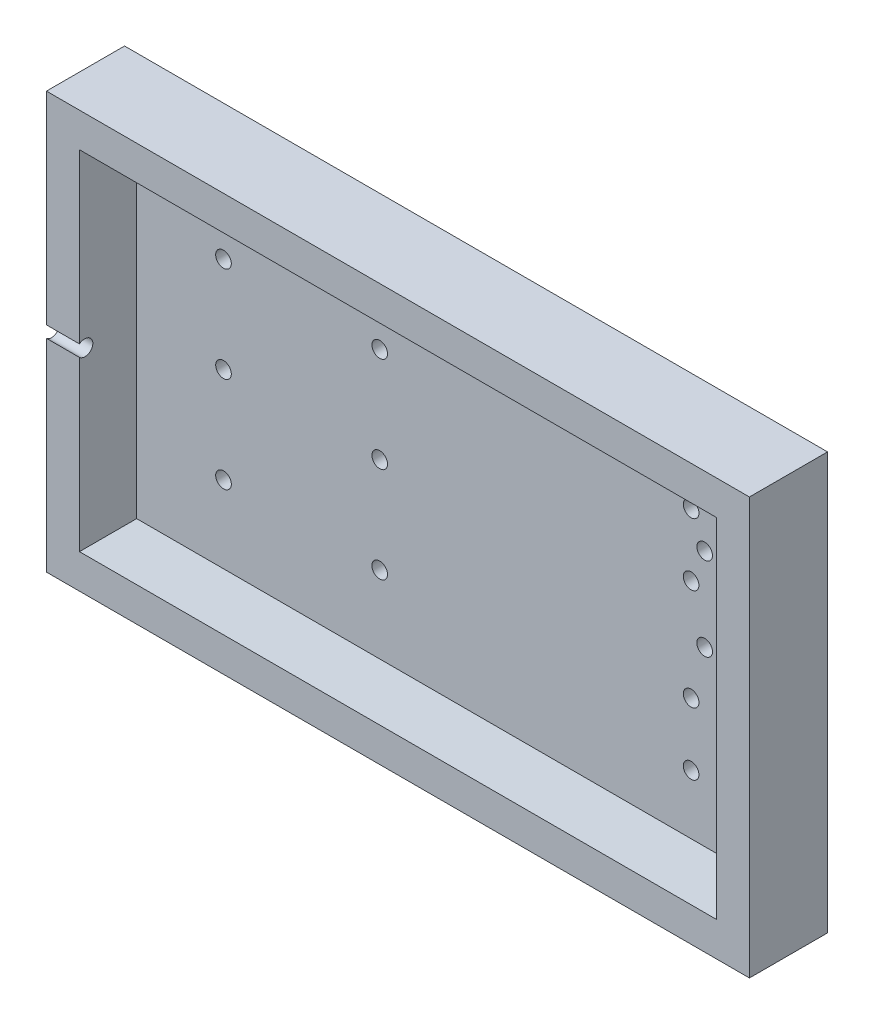
from build123d import *

# Parameters (mm, degrees)
SKETCH1_W           = 135
SKETCH1_H           = 80
BOSS_EXTRUDE1_DEPTH = 40
SKETCH2_R           = 1.5
CUT_EXTRUDE1_DEPTH  = 10
SKETCH3_R           = 1.5
CUT_EXTRUDE2_DEPTH  = 10
CAVITY1_START       = 5.91875
CAVITY1_DEPTH       = 68.1625
CAVITY1_START_2     = 5
CAVITY1_2_DEPTH     = 125
SKETCH4_W           = 135
SKETCH4_H           = 25
CUT_EXTRUDE3_DEPTH  = 100


with BuildPart() as part:
    # Sketch1 → Boss-Extrude1 (new body)
    with BuildSketch(Plane.XY):
        with Locations((67.5, 40)):
            Rectangle(SKETCH1_W, SKETCH1_H)
    extrude(amount=-BOSS_EXTRUDE1_DEPTH)

    # Sketch2 → Cut-Extrude1 (cut)
    with BuildSketch(Plane(origin=(0, 0, -40), x_dir=(-1, 0, 0), z_dir=(0, 0, -1))):
        with Locations((-53.3, 40)):
            Circle(SKETCH2_R)
        with Locations((-53.3, 58.35)):
            Circle(SKETCH2_R)
        with Locations((-53.3, 21.65)):
            Circle(SKETCH2_R)
        with Locations((-23.3, 58.35)):
            Circle(SKETCH2_R)
        with Locations((-23.3, 40)):
            Circle(SKETCH2_R)
        with Locations((-23.3, 21.65)):
            Circle(SKETCH2_R)
        with Locations((-115.7, 40)):
            Circle(SKETCH2_R)
        with Locations((-115.7, 56)):
            Circle(SKETCH2_R)
        with Locations((-113.1, 61.75)):
            Circle(SKETCH2_R)
        with Locations((-113.1, 49.75)):
            Circle(SKETCH2_R)
        with Locations((-113.1, 18.25)):
            Circle(SKETCH2_R)
        with Locations((-113.1, 30.25)):
            Circle(SKETCH2_R)
    extrude(amount=-CUT_EXTRUDE1_DEPTH, mode=Mode.SUBTRACT)

    # Sketch3 → Cut-Extrude2 (cut)
    with BuildSketch(Plane.ZY):
        with Locations((-10, 54.05)):
            Circle(SKETCH3_R)
        with Locations((-10, 25.95)):
            Circle(SKETCH3_R)
        with Locations((-26, 40)):
            Circle(SKETCH3_R)
    extrude(amount=-CUT_EXTRUDE2_DEPTH, mode=Mode.SUBTRACT)

    # Cavity1: read off the stored shape, not the designer's step
    # Cavity1 outline → Cavity1 (cut)
    with BuildSketch(Plane(origin=(0, 0, 0), x_dir=(1, 0, 0), z_dir=(0, 1, 0)).offset(CAVITY1_START)):
        Polygon((128.3771626, 35.7), (6.6228374, 35.7), (5.688, 0), (129.312, 0), align=None)
    extrude(amount=CAVITY1_DEPTH, mode=Mode.SUBTRACT)

    # Cavity1 2 outline → Cavity1 2 (add)
    with BuildSketch(Plane.YZ.offset(CAVITY1_START_2)):
        Polygon((74.08125, 0), (73.141830064, -35.7), (74.08125, -35.7), align=None)
        Polygon((6.858169936, -35.7), (5.91875, 0), (5.91875, -35.7), align=None)
    extrude(amount=CAVITY1_2_DEPTH)

    # Sketch4 → Cut-Extrude3 (cut)
    with BuildSketch(Plane(origin=(0, 80, 0), x_dir=(1, 0, 0), z_dir=(0, 1, 0))):
        with Locations((67.5, 12.5)):
            Rectangle(SKETCH4_W, SKETCH4_H)
    extrude(amount=-CUT_EXTRUDE3_DEPTH, mode=Mode.SUBTRACT)


solid = part.part
